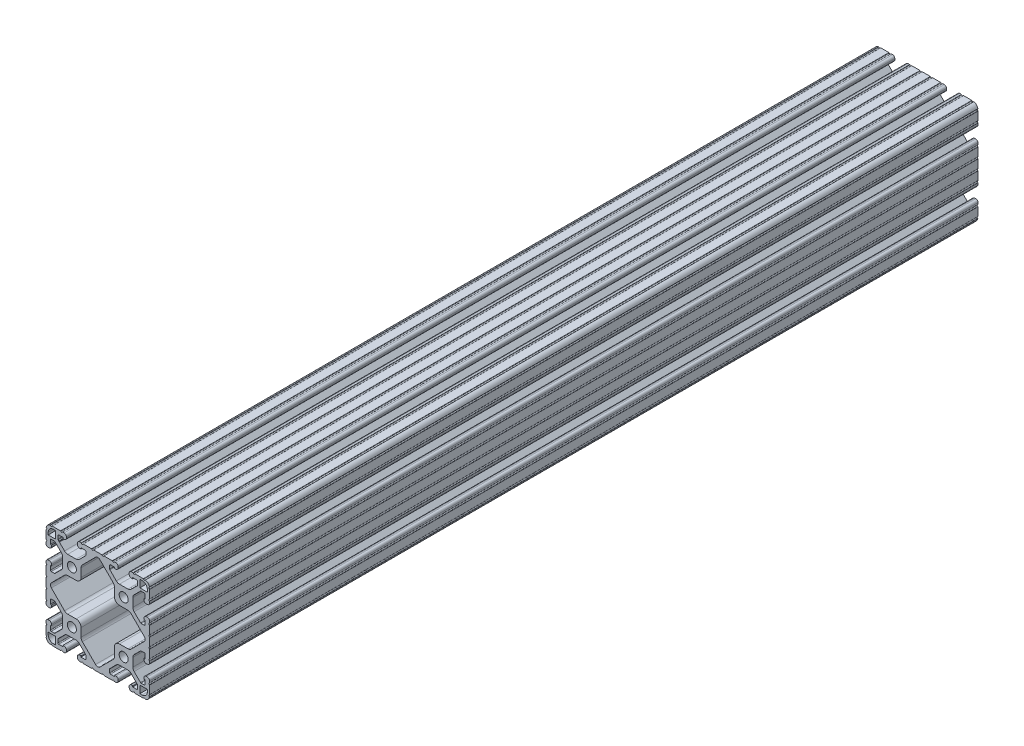
from build123d import *
from build123d.topology import SkipClean

# Parameters (mm, degrees)
BOSS_EXTRUDE1_DEPTH     = 304.8
BOSS_EXTRUDE3_DEPTH     = 304.8
SKETCH8_R               = 0.5715
CUT_EXTRUDE2_DEPTH      = 612.9766172
FILLET1_R               = 0.254
CUT_EXTRUDE1_DEPTH      = 310.52586334
CUT_EXTRUDE1_DEPTH_BACK = 310.52586334


with BuildPart() as part:
    # Sketch4 → Boss-Extrude1 (new, symmetric)
    with BuildSketch(Plane.XY):
        with BuildLine():
            Line((38.1, -34.29), (38.1, -24.7396))
            ThreePointArc((38.1, -24.7396), (37.623872783, -23.590127217), (36.4744, -23.114))
            Line((36.4744, -23.114), (35.6616, -23.114))
            ThreePointArc((35.6616, -23.114), (34.512127217, -23.590127217), (34.036, -24.7396))
            Line((34.036, -24.7396), (34.036, -25.68575))
            Line((34.036, -25.68575), (34.8488, -25.68575))
            Line((34.8488, -25.68575), (34.8488, -28.7274))
            ThreePointArc((34.8488, -28.7274), (34.670252294, -29.158452294), (34.2392, -29.337))
            Line((34.2392, -29.337), (31.888450155, -29.337))
            ThreePointArc((31.888450155, -29.337), (31.655166334, -29.290596963), (31.457397861, -29.158452294))
            Line((31.457397861, -29.158452294), (26.758654433, -24.459708866))
            ThreePointArc((26.758654433, -24.459708866), (26.053882864, -23.404943674), (25.8064, -22.160763299))
            Line((25.8064, -22.160763299), (25.8064, -19.05))
            Line((25.8064, -19.05), (22.3774, -19.05))
            ThreePointArc((22.3774, -19.05), (21.402827104, -21.402827104), (19.05, -22.3774))
            Line((19.05, -22.3774), (19.05, -25.8064))
            Line((19.05, -25.8064), (22.160763299, -25.8064))
            ThreePointArc((22.160763299, -25.8064), (23.404943674, -26.053882864), (24.459708866, -26.758654433))
            Line((24.459708866, -26.758654433), (29.158452294, -31.457397861))
            ThreePointArc((29.158452294, -31.457397861), (29.290596963, -31.655166334), (29.337, -31.888450155))
            Line((29.337, -31.888450155), (29.337, -34.2392))
            ThreePointArc((29.337, -34.2392), (29.158452294, -34.670252294), (28.7274, -34.8488))
            Line((28.7274, -34.8488), (25.68575, -34.8488))
            Line((25.68575, -34.8488), (25.68575, -34.036))
            Line((25.68575, -34.036), (24.7396, -34.036))
            ThreePointArc((24.7396, -34.036), (23.590127217, -34.512127217), (23.114, -35.6616))
            Line((23.114, -35.6616), (23.114, -36.4744))
            ThreePointArc((23.114, -36.4744), (23.590127217, -37.623872783), (24.7396, -38.1))
            Line((24.7396, -38.1), (34.29, -38.1))
            ThreePointArc((34.29, -38.1), (36.984076836, -36.984076836), (38.1, -34.29))
        make_face()
        with BuildLine():
            Line((32.6644, -36.4744), (30.9626, -36.4744))
            Line((30.9626, -36.4744), (30.9626, -30.9626))
            Line((30.9626, -30.9626), (36.4744, -30.9626))
            Line((36.4744, -30.9626), (36.4744, -32.6644))
            ThreePointArc((36.4744, -32.6644), (35.358476836, -35.358476836), (32.6644, -36.4744))
        make_face(mode=Mode.SUBTRACT)
    extrude(amount=BOSS_EXTRUDE1_DEPTH, both=True)

    # Sketch6 → Boss-Extrude3 (add, symmetric)
    with SkipClean():  # the faces are left unmerged after this step: merging them gives an invalid solid
        with BuildSketch(Plane.XY):
            with BuildLine():
                Line((13.640291134, -26.758654433), (8.941547706, -31.457397861))
                ThreePointArc((8.941547706, -31.457397861), (8.809403037, -31.655166334), (8.763, -31.888450155))
                Line((8.763, -31.888450155), (8.763, -34.2392))
                ThreePointArc((8.763, -34.2392), (8.941547706, -34.670252294), (9.3726, -34.8488))
                Line((9.3726, -34.8488), (12.41425, -34.8488))
                Line((12.41425, -34.8488), (12.41425, -34.036))
                Line((12.41425, -34.036), (13.3604, -34.036))
                ThreePointArc((13.3604, -34.036), (14.509872783, -34.512127217), (14.986, -35.6616))
                Line((14.986, -35.6616), (14.986, -36.4744))
                ThreePointArc((14.986, -36.4744), (14.509872783, -37.623872783), (13.3604, -38.1))
                Line((13.3604, -38.1), (0, -38.1))
                Line((0, -38.1), (0, -34.8488))
                ThreePointArc((0, -34.8488), (0.87976838, -34.673803189), (1.6256, -34.175454433))
                Line((1.6256, -34.175454433), (11.341345567, -24.459708866))
                ThreePointArc((11.341345567, -24.459708866), (12.046117136, -23.404943674), (12.2936, -22.160763299))
                Line((12.2936, -22.160763299), (12.2936, -15.939236701))
                ThreePointArc((12.2936, -15.939236701), (13.361382268, -13.361382268), (15.939236701, -12.2936))
                Line((15.939236701, -12.2936), (22.160763299, -12.2936))
                ThreePointArc((22.160763299, -12.2936), (23.404943674, -12.046117136), (24.459708866, -11.341345567))
                Line((24.459708866, -11.341345567), (34.175454433, -1.6256))
                ThreePointArc((34.175454433, -1.6256), (34.673803189, -0.87976838), (34.8488, 0))
                Line((34.8488, 0), (38.1, 0))
                Line((38.1, 0), (38.1, -13.3604))
                ThreePointArc((38.1, -13.3604), (37.623872783, -14.509872783), (36.4744, -14.986))
                Line((36.4744, -14.986), (35.6616, -14.986))
                ThreePointArc((35.6616, -14.986), (34.512127217, -14.509872783), (34.036, -13.3604))
                Line((34.036, -13.3604), (34.036, -12.41425))
                Line((34.036, -12.41425), (34.8488, -12.41425))
                Line((34.8488, -12.41425), (34.8488, -9.3726))
                ThreePointArc((34.8488, -9.3726), (34.670252294, -8.941547706), (34.2392, -8.763))
                Line((34.2392, -8.763), (31.888450155, -8.763))
                ThreePointArc((31.888450155, -8.763), (31.655166334, -8.809403037), (31.457397861, -8.941547706))
                Line((31.457397861, -8.941547706), (26.758654433, -13.640291134))
                ThreePointArc((26.758654433, -13.640291134), (26.053882864, -14.695056326), (25.8064, -15.939236701))
                Line((25.8064, -15.939236701), (25.8064, -19.05))
                Line((25.8064, -19.05), (22.3774, -19.05))
                ThreePointArc((22.3774, -19.05), (16.697172896, -16.697172896), (19.05, -22.3774))
                Line((19.05, -22.3774), (19.05, -25.8064))
                Line((19.05, -25.8064), (15.939236701, -25.8064))
                ThreePointArc((15.939236701, -25.8064), (14.695056326, -26.053882864), (13.640291134, -26.758654433))
            make_face()
        extrude(amount=BOSS_EXTRUDE3_DEPTH, both=True)

    # Sketch8 → Cut-Extrude2 (cut, through all)
    with SkipClean():  # the faces are left unmerged after this step: merging them gives an invalid solid
        with BuildSketch(Plane.XY.offset(304.8)):
            with Locations((38.1, -34.29)):
                Circle(SKETCH8_R)
            with Locations((38.1, -26.67)):
                Circle(SKETCH8_R)
            with Locations((38.1, -11.43)):
                Circle(SKETCH8_R)
            with Locations((38.1, -3.81)):
                Circle(SKETCH8_R)
            with Locations((34.29, -38.1)):
                Circle(SKETCH8_R)
            with Locations((26.67, -38.1)):
                Circle(SKETCH8_R)
            with Locations((11.43, -38.1)):
                Circle(SKETCH8_R)
            with Locations((3.81, -38.1)):
                Circle(SKETCH8_R)
        extrude(amount=-CUT_EXTRUDE2_DEPTH, mode=Mode.SUBTRACT)

    # Fillet1
    fillet1_edges = [part.edges().sort_by_distance(p)[0] for p in [
        (3.2385, -38.1, 0),
        (4.3815, -38.1, 0),
        (10.8585, -38.1, 0),
        (12.0015, -38.1, 0),
        (26.0985, -38.1, 0),
        (27.2415, -38.1, 0),
        (33.7185, -38.1, 0),
        (34.85989039, -38.0571375, 0),
        (38.0571375, -34.85989039, 0),
        (38.1, -33.7185, 0),
        (38.1, -27.2415, 0),
        (38.1, -26.0985, 0),
        (38.1, -12.0015, 0),
        (38.1, -10.8585, 0),
        (38.1, -3.2385, 0),
        (38.1, -4.3815, 0),
    ]]
    fillet(fillet1_edges, radius=FILLET1_R)

    # Mirror3: part across plane


with BuildPart() as part_1:
    with SkipClean():  # the faces are left unmerged after this step: merging them gives an invalid solid
        add(part.part)
        add(part.part.mirror(Plane.ZX))

    # Mirror6: part across plane


with BuildPart() as part_2:
    with SkipClean():  # the faces are left unmerged after this step: merging them gives an invalid solid
        add(part_1.part)
        add(part_1.part.mirror(Plane(origin=(0, 0, 0), x_dir=(0, 0, 1), z_dir=(1, 0, 0))))

    # Sketch7 → Cut-Extrude1 (cut, two sides: drawn at the far end of the back side and taken through both)
    with SkipClean():  # the faces are left unmerged after this step: merging them gives an invalid solid
        with BuildSketch(Plane.XY.offset(-CUT_EXTRUDE1_DEPTH_BACK)):
            Polygon((-28.663654433, 30.9626), (-28.663654433, 30.5562), (-28.257254433, 30.5562), align=None)
        extrude(amount=CUT_EXTRUDE1_DEPTH + CUT_EXTRUDE1_DEPTH_BACK, mode=Mode.SUBTRACT)


solid = part_2.part
